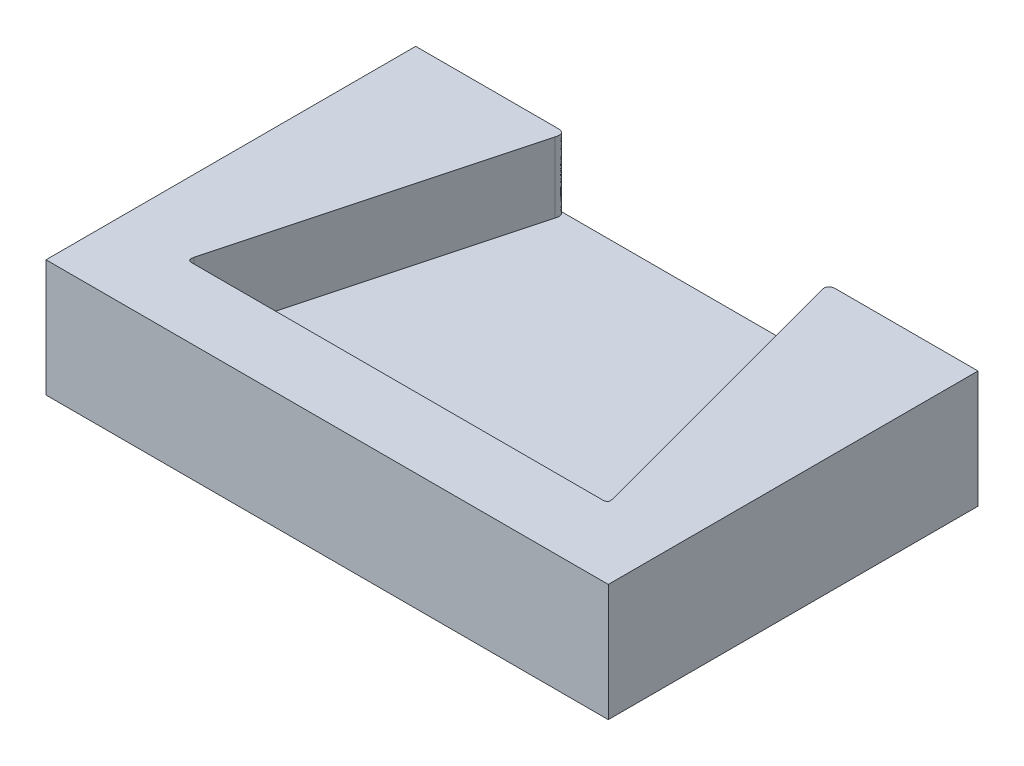
from build123d import *

# Parameters (mm, degrees)
SKETCH1_W           = 24
SKETCH1_H           = 15.78
BOSS_EXTRUDE1_DEPTH = 5
CUT_EXTRUDE1_DEPTH  = 3


with BuildPart() as part:
    # Sketch1 → Boss-Extrude1 (new body)
    with BuildSketch(Plane(origin=(0, 0, 0), x_dir=(1, 0, 0), z_dir=(0, 1, 0))):
        with Locations((12, 7.89)):
            Rectangle(SKETCH1_W, SKETCH1_H)
    extrude(amount=BOSS_EXTRUDE1_DEPTH)

    # Sketch2 → Cut-Extrude1 (cut)
    with BuildSketch(Plane(origin=(0, 5, 0), x_dir=(1, 0, 0), z_dir=(0, 1, 0))):
        Polygon((6.424390679, 15.78), (3, 3), (21, 3), (17.575609321, 15.78), align=None)
    extrude(amount=-CUT_EXTRUDE1_DEPTH, mode=Mode.SUBTRACT)

    # Fillet1
    # a fillet whose section is not a circle: 0.2 mm, written as the material it adds along each edge
    with BuildSketch(Plane(origin=(21, 5, -3), x_dir=(-1, 0, 0), z_dir=(0, -1, 0)), Plane(origin=(3, 5, -3), x_dir=(0.25881904510252013, 0, -0.9659258262890685), z_dir=(0, -1, 0))) as fillet1_piece_1:
        with BuildLine():
            add(Edge.make_bspline([(0.260645075, 0), (0.21890515, 0), (0.177165225, 0), (0.086689828, 0.021204892), (0.042919331, 0.078247714), (0.045853734, 0.171128466), (0.056656822, 0.211446138), (0.067459909, 0.251763809)], knots=[0, 0, 0, 0, 0, 0, 0.5, 0.5, 1, 1, 1, 1, 1, 1], degree=5))
            Line((0.067459909, 0.251763809), (0, 0))
            Line((0, 0), (0.260645075, 0))
        make_face()
    extrude(amount=3.651612686)

    # Fillet2
    # a fillet whose section is not a circle: 0.3 mm, written as the material it takes off along each edge
    with BuildSketch(Plane(origin=(6.424390679, 5.97741903, -15.78), x_dir=(-1, 0, 0), z_dir=(0, -1, 0)), Plane(origin=(17.575609321, 5.97741903, -15.78), x_dir=(0.25881904510251846, 0, 0.9659258262890689), z_dir=(0, -1, 0))) as fillet2_piece_1:
        with BuildLine():
            add(Edge.make_bspline([(0.390967612, 0), (0.328357725, 0), (0.265747838, 0), (0.130034743, -0.031807338), (0.064378997, -0.117371571), (0.068780602, -0.2566927), (0.084985233, -0.317169207), (0.101189864, -0.377645714)], knots=[0, 0, 0, 0, 0, 0, 0.5, 0.5, 1, 1, 1, 1, 1, 1], degree=5))
            Line((0.101189864, -0.377645714), (0, 0))
            Line((0, 0), (0.390967612, 0))
        make_face()
    extrude(amount=3.97741903, mode=Mode.SUBTRACT)


solid = part.part
